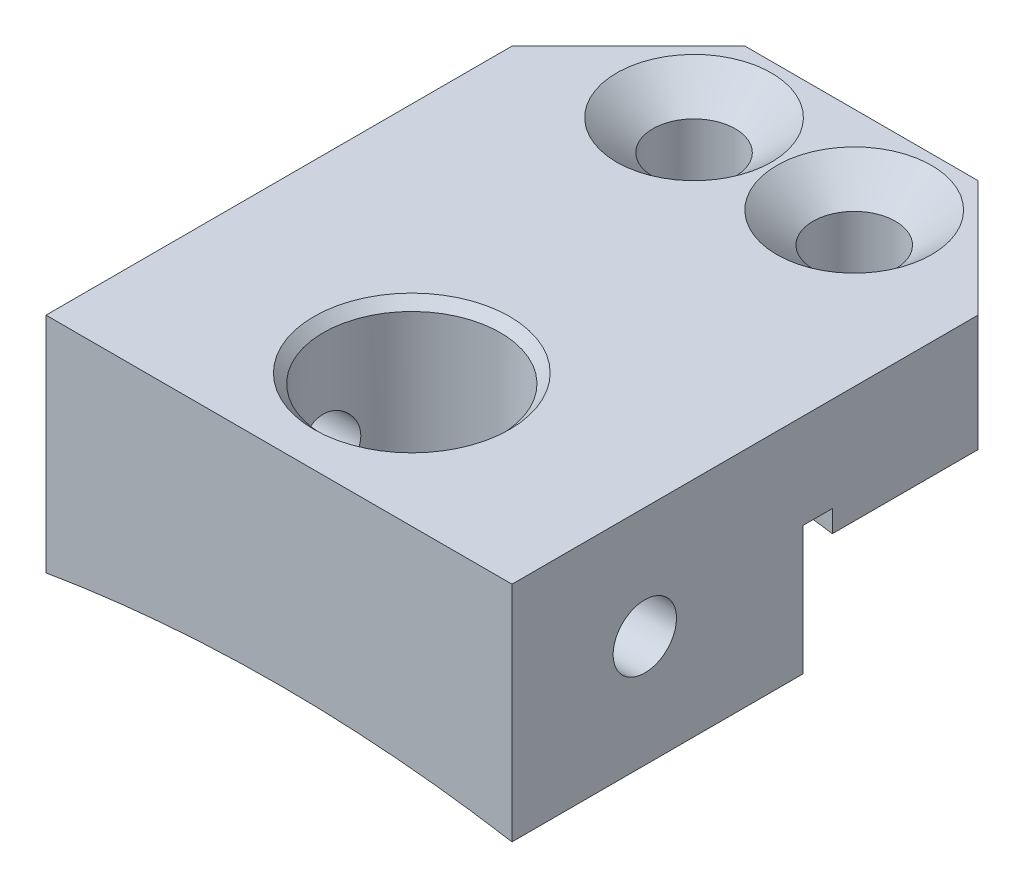
from build123d import *

# Parameters (mm, degrees)
SKETCH1_W                                         = 25.4
SKETCH1_H                                         = 31.75
BOSS_EXTRUDE1_DEPTH                               = 6.35
CUT_EXTRUDE1_DEPTH                                = 35.780382402
BOSS_EXTRUDE2_DEPTH                               = 15.875
SKETCH4_W                                         = 1.5875
SKETCH4_H                                         = 1.190625
CUT_EXTRUDE2_DEPTH                                = 31.618591166
CHAMFER1_SIZE                                     = 6.35
SKETCH5_R                                         = 1.524
CUT_EXTRUDE3_DEPTH                                = 24.692140063
CSK_FOR_8_FLAT_HEAD_MACHINE_SCREW_100_D           = 4.4958
CSK_FOR_8_FLAT_HEAD_MACHINE_SCREW_100_CSINK_D     = 8.4328
CSK_FOR_8_FLAT_HEAD_MACHINE_SCREW_100_CSINK_ANGLE = 100
SKETCH8_R                                         = 4.826
CUT_EXTRUDE4_DEPTH                                = 24.692140235
CHAMFER2_SIZE                                     = 0.508
F_8_32_TAPPED_HOLE1_D                             = 3.4544


with BuildPart() as part:
    # Sketch1 → Boss-Extrude1 (new body)
    with BuildSketch(Plane(origin=(0, 0, 0), x_dir=(1, 0, 0), z_dir=(0, 1, 0))):
        Rectangle(SKETCH1_W, SKETCH1_H)
    extrude(amount=BOSS_EXTRUDE1_DEPTH)

    # Sketch2 → Cut-Extrude1 (cut, through all)
    with BuildSketch(Plane.XY.offset(15.875)):
        with BuildLine():
            Line((-12.7, 0), (12.7, 0))
            ThreePointArc((12.7, 0), (0, 0.990173613), (-12.7, 0))
        make_face()
    extrude(amount=-CUT_EXTRUDE1_DEPTH, mode=Mode.SUBTRACT)

    # Sketch3 → Boss-Extrude2 (add)
    with BuildSketch(Plane.XY.offset(15.875)):
        with BuildLine():
            Line((-12.7, 6.35), (12.7, 6.35))
            Line((12.7, 6.35), (12.7, -5.816013142))
            ThreePointArc((12.7, -5.816013142), (0, -4.750226387), (-12.7, -5.816013142))
            Line((-12.7, -5.816013142), (-12.7, 6.35))
        make_face()
    extrude(amount=-BOSS_EXTRUDE2_DEPTH)

    # Sketch4 → Cut-Extrude2 (cut, through all)
    with BuildSketch(Plane.ZY.offset(12.7)):
        with Locations((-0.79375, 0.5953125)):
            Rectangle(SKETCH4_W, SKETCH4_H)
    extrude(amount=-CUT_EXTRUDE2_DEPTH, mode=Mode.SUBTRACT)

    # Chamfer1
    chamfer1_edges = [part.edges().sort_by_distance(p)[0] for p in [
        (-12.7, 3.175, -15.875),
        (12.7, 3.175, -15.875),
    ]]
    chamfer(chamfer1_edges, length=CHAMFER1_SIZE)

    # Sketch5 → Cut-Extrude3 (cut, through all)
    with BuildSketch(Plane(origin=(0, 6.35, 0), x_dir=(1, 0, 0), z_dir=(0, 1, 0))):
        with Locations((0, -8.636)):
            Circle(SKETCH5_R)
    extrude(amount=-CUT_EXTRUDE3_DEPTH, mode=Mode.SUBTRACT)

    # CSK for #8 Flat Head Machine Screw (100)1 (through all)
    with Locations(Plane(origin=(0, 6.35, 0), x_dir=(1, 0, 0), z_dir=(0, 1, 0))):
        with Locations((-4.365625, 11.1125), (4.365625, 11.1125)):
            CounterSinkHole(CSK_FOR_8_FLAT_HEAD_MACHINE_SCREW_100_D / 2, CSK_FOR_8_FLAT_HEAD_MACHINE_SCREW_100_CSINK_D / 2, counter_sink_angle=CSK_FOR_8_FLAT_HEAD_MACHINE_SCREW_100_CSINK_ANGLE)

    # Sketch8 → Cut-Extrude4 (cut, through all)
    with BuildSketch(Plane(origin=(0, 6.35, 0), x_dir=(1, 0, 0), z_dir=(0, 1, 0))):
        with Locations((0, -8.636)):
            Circle(SKETCH8_R)
    extrude(amount=-CUT_EXTRUDE4_DEPTH, mode=Mode.SUBTRACT)

    # Chamfer2
    chamfer2_edges = [part.edges().sort_by_distance(p)[0] for p in [
        (-4.826, 6.35, 8.636),
    ]]
    chamfer(chamfer2_edges, length=CHAMFER2_SIZE)

    # #8-32 Tapped Hole1 (through all)
    with Locations(Plane.ZY.offset(12.7)):
        with Locations((8.636, 0.266993429)):
            Hole(F_8_32_TAPPED_HOLE1_D / 2)


solid = part.part
